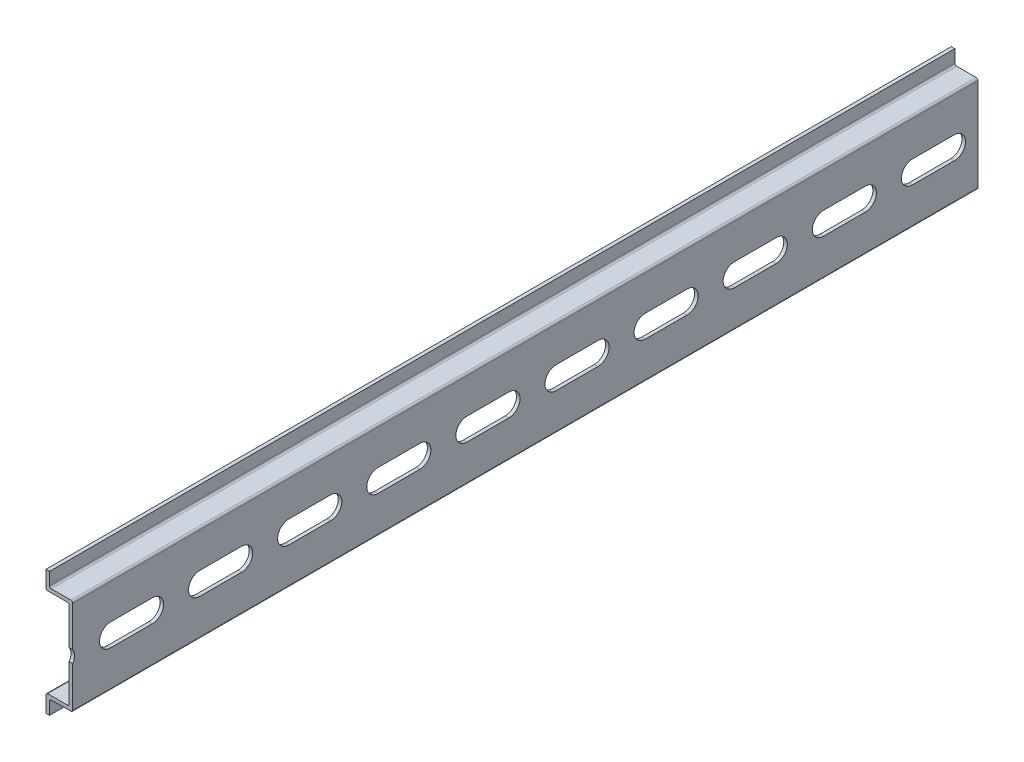
from build123d import *

# Parameters (mm, degrees)
EXTRUDE_THIN1_DEPTH = 449.2625
CUT_EXTRUDE1_DEPTH  = 450.665757987
LPATTERN1_COUNT     = 18
LPATTERN1_PITCH     = 25
FILLET1_R           = 0.5
SKETCH5_W           = 13.158199176
SKETCH5_H           = 40.042206119
CUT_EXTRUDE2_DEPTH  = 195.2625


with BuildPart() as part:
    # Sketch3 → Extrude-Thin1 (new body)
    with BuildSketch(Plane.XY):
        Polygon((-6.5, 17.5), (-6.5, 13.5), (0, 13.5), (0, -13.5), (-6.5, -13.5), (-6.5, -17.5), (-7.5, -17.5), (-7.5, -12.5), (-1, -12.5), (-1, 12.5), (-7.5, 12.5), (-7.5, 17.5), align=None)
    extrude(amount=EXTRUDE_THIN1_DEPTH)

    # Sketch4 → Cut-Extrude1 (cut, symmetric)
    with BuildSketch(Plane(origin=(0, 0, 0), x_dir=(0, 0, -1), z_dir=(1, 0, 0))):
        with BuildLine():
            Line((-6.65, -3.15), (-18.35, -3.15))
            ThreePointArc((-18.35, -3.15), (-21.5, 0), (-18.35, 3.15))
            Line((-18.35, 3.15), (-6.65, 3.15))
            ThreePointArc((-6.65, 3.15), (-3.5, 0), (-6.65, -3.15))
        make_face()
    cut_extrude1 = extrude(amount=CUT_EXTRUDE1_DEPTH, both=True, mode=Mode.SUBTRACT)

    # LPattern1: Cut-Extrude1 ×18
    with Locations(*[(0, 0, i * LPATTERN1_PITCH) for i in range(1, LPATTERN1_COUNT)]):
        add(cut_extrude1, mode=Mode.SUBTRACT)

    # Fillet1
    fillet1_edges = [part.edges().sort_by_distance(p)[0] for p in [
        (0, -13.5, 224.63125),
        (0, 13.5, 224.63125),
        (-6.5, 13.5, 224.63125),
        (-6.5, -13.5, 224.63125),
        (-1, 12.5, 224.63125),
        (-1, -12.5, 224.63125),
        (-7.5, -12.5, 224.63125),
        (-7.5, 12.5, 224.63125),
    ]]
    fillet(fillet1_edges, radius=FILLET1_R)

    # Sketch5 → Cut-Extrude2 (cut)
    with BuildSketch(Plane.XY.offset(449.2625)):
        with Locations((-4.513311055, 1.584769395)):
            Rectangle(SKETCH5_W, SKETCH5_H)
    extrude(amount=-CUT_EXTRUDE2_DEPTH, mode=Mode.SUBTRACT)


solid = part.part
